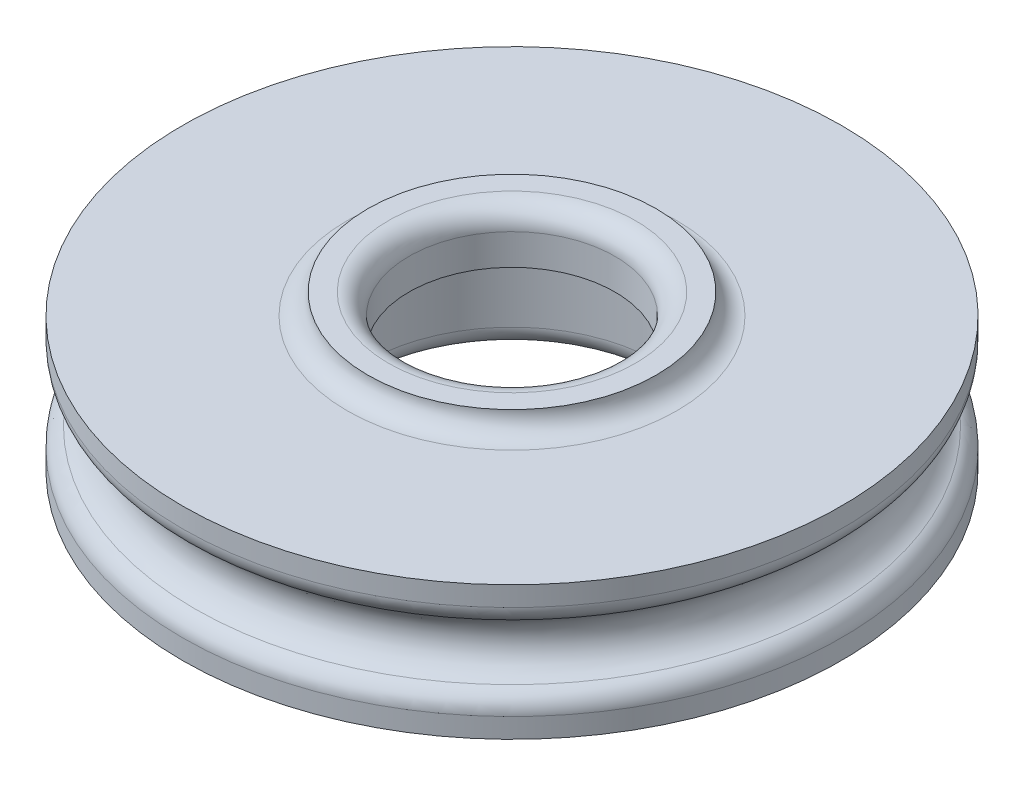
from build123d import *

# Parameters (mm, degrees)
SKETCH1_R           = 8
SKETCH1_R_2         = 3.55
BOSS_EXTRUDE1_DEPTH = 1.625
SKETCH3_R           = 4
SKETCH3_R_2         = 2.5
BOSS_EXTRUDE2_DEPTH = 0.75
BOSS_EXTRUDE3_START = 0.5
SKETCH4_R           = 3.5
SKETCH4_R_2         = 2.5
BOSS_EXTRUDE3_DEPTH = 0.5
FILLET2_R           = 0.5


with BuildPart() as part:
    # Sketch1 → Boss-Extrude1 (new, symmetric)
    with BuildSketch(Plane(origin=(0, 0, 0), x_dir=(1, 0, 0), z_dir=(0, 1, 0))):
        with Locations(Location((0, 0, 0), (0, 0, 90))):
            Circle(SKETCH1_R)
        with Locations(Location((0, 0, 0), (0, 0, 90))):
            Circle(SKETCH1_R_2, mode=Mode.SUBTRACT)
    extrude(amount=BOSS_EXTRUDE1_DEPTH, both=True)

    # Sketch2 → Cut-Revolve1 (revolve, cut)
    with BuildSketch(Plane(origin=(0, 0, 0), x_dir=(0, 0, -1), z_dir=(1, 0, 0)), mode=Mode.PRIVATE) as cut_revolve1_sk:
        with BuildLine():
            Line((-8, 0.75), (-8, -0.75))
            add(Edge.make_bspline(
                [(-8, -0.75), (-7.25, -0.75), (-7.25, 0), (-7.25, 0.75), (-8, 0.75)],
                knots=[4.71238898, 4.71238898, 4.71238898, 6.283185307, 6.283185307, 7.853981634, 7.853981634, 7.853981634], degree=2, weights=[1, 0.707106781, 1, 0.707106781, 1]))
        make_face()
    revolve(cut_revolve1_sk.sketch.rotate(Axis((0, 1.625, 0), (0, -1, 0)), 180), axis=Axis((0, 1.625, 0), (0, -1, 0)), mode=Mode.SUBTRACT)

    # Sketch3 → Boss-Extrude2 (add)
    with BuildSketch(Plane(origin=(0, 1.625, 0), x_dir=(1, 0, 0), z_dir=(0, 1, 0))):
        Circle(SKETCH3_R)
        with Locations(Location((0, 0, 0), (0, 0, 270))):
            Circle(SKETCH3_R_2, mode=Mode.SUBTRACT)
    extrude(amount=-BOSS_EXTRUDE2_DEPTH)

    # Sketch4 → Boss-Extrude3 (add)
    with BuildSketch(Plane(origin=(0, 1.625, 0), x_dir=(1, 0, 0), z_dir=(0, 1, 0)).offset(BOSS_EXTRUDE3_START)):
        with Locations(Location((0, 0, 0), (0, 0, 270))):
            Circle(SKETCH4_R)
        with Locations(Location((0, 0, 0), (0, 0, 270))):
            Circle(SKETCH4_R_2, mode=Mode.SUBTRACT)
    extrude(amount=-BOSS_EXTRUDE3_DEPTH)

    # Fillet2
    fillet2_edges = [part.edges().sort_by_distance(p)[0] for p in [
        (0, 0.75, 8),
        (0, -0.75, 8),
        (0, 0.875, 3.55),
        (0, 1.625, -3.5),
        (0, 2.125, -2.5),
        (0, -1.625, 3.55),
    ]]
    fillet(fillet2_edges, radius=FILLET2_R - 0.0001)  # a hair under: the kernel refuses the full size


solid = part.part
